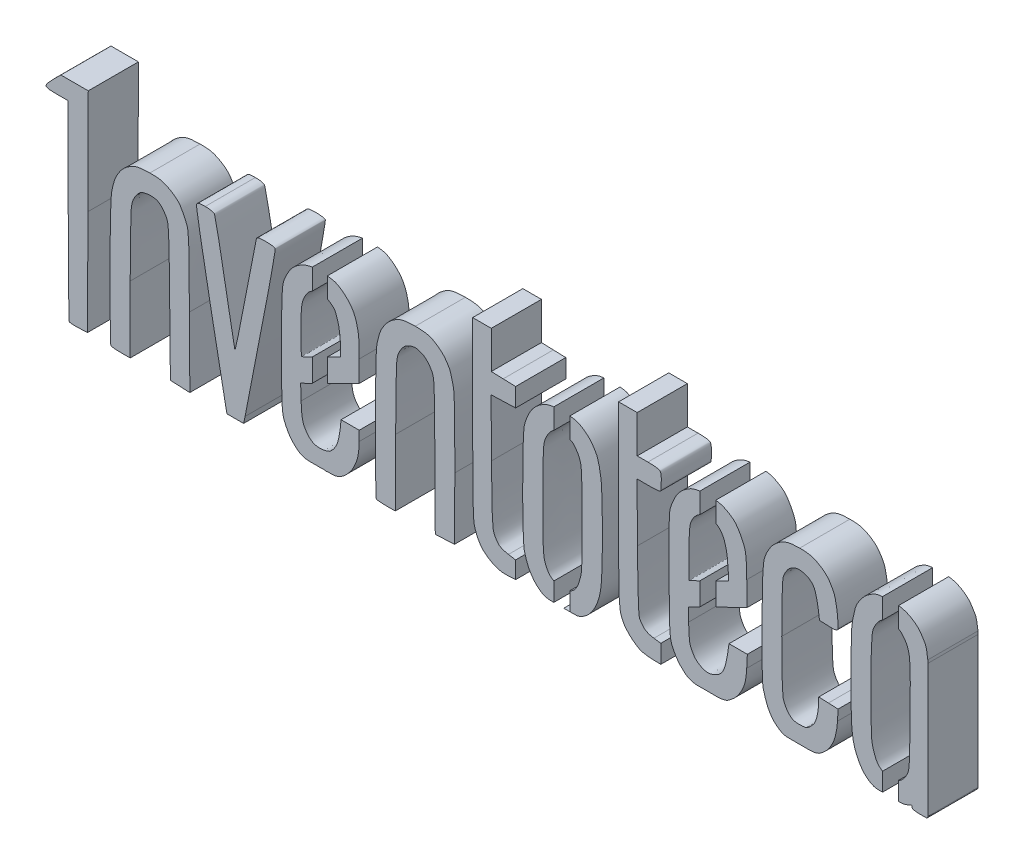
from build123d import *

# Parameters (mm, degrees)
SALIENTE_EXTRUIR2_DEPTH    = 10
CORTAR_EXTRUIR2_DEPTH      = 92.32283264
CORTAR_EXTRUIR2_DEPTH_BACK = 10
CROQUIS3_W                 = 3
CROQUIS3_H                 = 32.702645234
CROQUIS3_W_2               = 3.190612873
CROQUIS3_H_2               = 33.860503912
CROQUIS3_W_3               = 3.190612874
CROQUIS3_H_3               = 32.685335234
CROQUIS3_H_4               = 33.895445


# Read off the part's stored shape, not the designer's step: Saliente-Extruir2
with BuildPart() as part:
    # Saliente-Extruir2 outline → Saliente-Extruir2 (new body)
    # profile 1 of 11: a face of its own
    with BuildSketch(Plane.XY):
        with BuildLine():
            Line((-79.218099, -20.805759), (-79.146962, 0.095706))
            Line((-79.146962, 0.095706), (-79.075822, 21.000126))
            Line((-79.075822, 21.000126), (-84.541357, 21.000126))
            Line((-84.541357, 21.000126), (-86.020408, 19.539183))
            add(Edge.make_bspline(
                [(-86.020408, 19.539183), (-86.151057621, 19.407755057), (-86.403586436, 19.153721848), (-86.749067675, 18.776474773), (-87.004990583, 18.477835265), (-87.178945876, 18.258517235), (-87.285530373, 18.115907349), (-87.371645243, 17.989227664), (-87.439067324, 17.881342053), (-87.486328293, 17.788830583), (-87.50620533, 17.699889639), (-87.487234219, 17.614245837), (-87.433336517, 17.539963321), (-87.350967832, 17.48108526), (-87.2427641, 17.43566171), (-87.108126477, 17.398274028), (-86.867794342, 17.353677945), (-86.480480122, 17.31654641), (-85.904991074, 17.292995367), (-85.47191392, 17.291033463), (-85.229215, 17.289934)],
                knots=[0, 0, 0, 0, 0.115945695, 0.224108027, 0.320001004, 0.361964092, 0.399248074, 0.431375434, 0.457779313, 0.478835901, 0.496179998, 0.513637565, 0.531920245, 0.552362112, 0.576220356, 0.605016122, 0.639659586, 0.729037154, 0.848150868, 1, 1, 1, 1], degree=3))
            Line((-85.229215, 17.289934), (-83.066724, 17.289934))
            Line((-83.066724, 17.289934), (-83.066724, -1.589843))
            add(Edge.make_bspline(
                [(-83.066724, -1.589843), (-83.065439587, -3.26500503), (-83.062995174, -6.453065158), (-83.043420962, -10.929776943), (-83.018264646, -14.272178965), (-82.992078082, -16.563247392), (-82.971746807, -17.940258425), (-82.952612081, -18.928617905), (-82.935775964, -19.582981599), (-82.923712205, -19.964875403), (-82.912919084, -20.235684937), (-82.903822514, -20.413352857), (-82.897387989, -20.516735365), (-82.891715788, -20.590262338), (-82.886901015, -20.63896759), (-82.883485834, -20.668123289), (-82.880215269, -20.689429533), (-82.877748697, -20.704351243), (-82.87573651, -20.714244279), (-82.872885393, -20.723471214), (-82.87110743, -20.733571051), (-82.865753575, -20.746036469), (-82.850986578, -20.762380567), (-82.827662032, -20.780873949), (-82.794961899, -20.79680976), (-82.758049779, -20.809929322), (-82.716140494, -20.822273459), (-82.668605152, -20.833379757), (-82.594329202, -20.847735423), (-82.487961002, -20.863187422), (-82.345129737, -20.878057236), (-82.119335183, -20.894592686), (-81.800693744, -20.905825794), (-81.385114196, -20.906550917), (-81.093989627, -20.895082517), (-80.94319, -20.889142)],
                knots=[0, 0, 0, 0, 0.238070831, 0.453081021, 0.636226859, 0.7130989, 0.778704184, 0.831946137, 0.853587958, 0.871731508, 0.886246948, 0.892104564, 0.897013991, 0.900967726, 0.902584103, 0.903969484, 0.905138999, 0.905647015, 0.906119144, 0.906572339, 0.907017613, 0.9075736, 0.908472856, 0.910111159, 0.911781099, 0.913613368, 0.915676988, 0.917986328, 0.920548232, 0.926426521, 0.933254253, 0.940953551, 0.958597667, 0.978554004, 1, 1, 1, 1], degree=3))
            Line((-80.94319, -20.889142), (-79.218099, -20.805759))
        make_face()
    # profile 2 of 11: a face of its own
    with BuildSketch(Plane.XY):
        with BuildLine():
            Line((88.311123, 5.837721), (88.302478, 6.440604))
            add(Edge.make_bspline(
                [(88.302478, 6.440604), (88.282305496, 6.609175455), (88.220250139, 7.127740808), (88.091477079, 7.939534304), (87.894132078, 8.804306263), (87.478801986, 9.472824703), (87.098273468, 10.081076168), (86.677328234, 10.72132247), (86.091319874, 11.308745292), (85.368926427, 11.843493072), (84.49953473, 12.340381186), (83.523703275, 12.718396014), (82.38006427, 12.940584356), (81.587538344, 12.953521904), (81.15689, 12.960552)],
                knots=[0, 0, 0, 0, 0.047149464, 0.145042816, 0.229100541, 0.290415826, 0.362081233, 0.429042106, 0.502564977, 0.591198842, 0.678137552, 0.780107814, 0.880513429, 1, 1, 1, 1], degree=3))
            add(Edge.make_bspline(
                [(81.15689, 12.960552), (80.781049535, 12.952573226), (80.042077823, 12.936885483), (79.034933057, 12.830962362), (78.140634637, 12.705225303), (77.357516659, 12.347096285), (76.598381099, 11.870220177), (75.822866579, 11.269367672), (75.136716868, 10.497529596), (74.531952458, 9.653539229), (74.000705858, 8.721925124), (73.671117894, 7.599110182), (73.384727799, 6.324011927), (73.133011037, 4.683874633), (73.046385189, 2.394038035), (72.95714166, -0.668749673), (72.924674413, -4.266365166), (72.95680578, -7.858879197), (73.045198049, -10.908561632), (73.151759857, -13.231192449), (73.409605127, -14.903191749), (73.783002421, -16.289678337), (74.301834412, -17.511304626), (74.899791981, -18.582579559), (75.564342641, -19.465759464), (76.318952065, -20.133924756), (77.08110237, -20.628244243), (77.918604778, -20.915243109), (78.479286722, -20.917464892), (78.775076, -20.918637)],
                knots=[0, 0, 0, 0, 0.027265503, 0.05360901, 0.073606059, 0.092359671, 0.115529994, 0.138687807, 0.163281208, 0.190165697, 0.21404657, 0.240675843, 0.274653621, 0.308989324, 0.360915825, 0.440801379, 0.531490022, 0.622038654, 0.701564839, 0.753011837, 0.790661555, 0.824142607, 0.856969427, 0.886735022, 0.913056099, 0.936750601, 0.959542632, 0.978656606, 1, 1, 1, 1], degree=3))
            Line((78.775076, -20.918637), (81.710189, -20.922644))
            Line((81.710189, -20.922644), (82.624444, -20.934893))
            add(Edge.make_bspline(
                [(82.624444, -20.934893), (82.814961255, -20.927469101), (83.211361597, -20.912022543), (83.789036959, -20.79555297), (84.278341245, -20.616691078), (84.630954123, -20.416501474), (84.862488026, -20.305155684), (84.99748096, -20.237337864), (85.056495765, -20.240482069), (85.069620735, -20.243571856), (85.079157794, -20.248430513), (85.087023564, -20.254964786), (85.094087979, -20.264749292), (85.104381641, -20.286574385), (85.113245262, -20.328005662), (85.119707302, -20.392563492), (85.119510898, -20.47189942), (85.125401716, -20.558363845), (85.154034275, -20.641848934), (85.204748586, -20.715308802), (85.277935706, -20.77529819), (85.371025742, -20.823196018), (85.536896658, -20.87618802), (85.805512193, -20.934806981), (86.212882505, -20.988857108), (86.595247243, -21.002267186), (86.993781496, -20.997334983), (87.352141086, -20.995141194), (87.638492529, -20.988195813), (87.773345, -20.984925)],
                knots=[0, 0, 0, 0, 0.100353028, 0.208799852, 0.30891934, 0.373811957, 0.421046265, 0.446661669, 0.449751081, 0.451996252, 0.453713543, 0.455343419, 0.457336748, 0.460017531, 0.468006459, 0.479462806, 0.494193237, 0.509810045, 0.52488272, 0.540092088, 0.556237267, 0.574226853, 0.594938269, 0.647796861, 0.718902539, 0.811186014, 0.849077055, 0.928925338, 1, 1, 1, 1], degree=3))
            add(Edge.make_bspline(
                [(87.773345, -20.984925), (87.878260491, -20.995018697), (88.048383551, -21.011385877), (88.282444399, -20.849377969), (88.299416353, -20.683848585), (88.309542, -20.585092)],
                knots=[0, 0, 0, 0, 0.393583621, 0.638205563, 1, 1, 1, 1], degree=3))
            Line((88.309542, -20.585092), (88.311123, 5.837721))
        make_face()
        with BuildLine():
            add(Edge.make_bspline(
                [(81.057047, 9.116124), (81.349885696, 9.122860584), (81.871823097, 9.112244989), (82.624370182, 8.832742783), (83.200678123, 8.327021836), (83.72959394, 7.685686787), (84.147479536, 6.923660537), (84.569749723, 5.849514155), (84.786846331, 3.907506361), (84.822485623, 0.261232339), (84.796547648, -4.114838059), (84.756697074, -8.28979707), (84.716916399, -11.037655943), (84.656537774, -12.895640492), (84.566388582, -14.09930628), (84.413623643, -14.889872181), (84.145728277, -15.500842773), (83.794531572, -16.067967766), (83.383679929, -16.595544979), (82.954699226, -17.031370602), (82.45625329, -17.299253361), (81.954314696, -17.507084459), (81.424919647, -17.658039472), (80.863465307, -17.670210316), (80.291606222, -17.620115404), (79.696077795, -17.516051463), (79.12737418, -17.237129825), (78.605967416, -16.793437653), (78.119556691, -16.201313935), (77.745169253, -15.387455026), (77.420774679, -14.435768925), (77.089254953, -13.085745957), (77.00253047, -10.882386176), (76.926466689, -7.425570332), (76.956441586, -3.472692704), (76.99781847, 0.114784893), (77.040167317, 2.613918244), (77.105413322, 4.312835095), (77.203362937, 5.442762087), (77.380289998, 6.229573716), (77.661360156, 6.900499658), (78.034665201, 7.558440464), (78.488071114, 8.156313818), (78.976672993, 8.649559857), (79.593409061, 8.910347014), (80.287918892, 9.078539332), (80.793812189, 9.110068436), (81.057047, 9.116124)],
                knots=[0, 0, 0, 0, 0.014188249, 0.025167113, 0.038251926, 0.050962096, 0.065503895, 0.080335806, 0.106831477, 0.159724291, 0.258045857, 0.319580663, 0.362878011, 0.391747318, 0.409998922, 0.421596909, 0.43068422, 0.442285707, 0.453958916, 0.463220843, 0.471747884, 0.481243836, 0.489686264, 0.498328905, 0.508364834, 0.517647634, 0.52754889, 0.538747309, 0.550751247, 0.564518767, 0.58202687, 0.599689551, 0.631910051, 0.688832293, 0.768153251, 0.824106776, 0.863406785, 0.889743845, 0.906825493, 0.918516497, 0.928799329, 0.942106796, 0.955187263, 0.965323076, 0.975382589, 0.987246081, 1, 1, 1, 1], degree=3))
        make_face(mode=Mode.SUBTRACT)
    # profile 3 of 11: a face of its own
    with BuildSketch(Plane.XY):
        with BuildLine():
            Line((66.720352, 2.468552), (68.452826, 2.384746))
            add(Edge.make_bspline(
                [(68.452826, 2.384746), (68.647507005, 2.376376701), (68.99346846, 2.361503883), (69.454584411, 2.364625097), (69.766689494, 2.392577076), (69.963576832, 2.436524133), (70.079690858, 2.477225129), (70.176874032, 2.529350369), (70.255556493, 2.594339736), (70.315473167, 2.671502042), (70.35830883, 2.756160899), (70.382453457, 2.855512917), (70.395133904, 2.974260822), (70.40315939, 3.122429049), (70.407019715, 3.299339581), (70.405833682, 3.502612617), (70.397795118, 3.81743707), (70.375203439, 4.253671102), (70.331772887, 4.813454017), (70.251011392, 5.619276473), (70.102518285, 6.620842501), (69.883242004, 7.69218358), (69.641588188, 8.576035142), (69.275436214, 9.28279583), (68.889246373, 9.937145018), (68.454476282, 10.608437398), (67.848181166, 11.21351133), (67.118253786, 11.773792899), (66.237591964, 12.300538653), (65.258974499, 12.725040732), (64.06325152, 12.956125965), (63.231967452, 12.961667593), (62.764184, 12.964786)],
                knots=[0, 0, 0, 0, 0.035121612, 0.062413505, 0.083103872, 0.091437, 0.098720786, 0.105217816, 0.111216516, 0.116972089, 0.122715165, 0.128178974, 0.135299765, 0.144223812, 0.154923219, 0.167193973, 0.180865004, 0.211692235, 0.245925745, 0.282070913, 0.357677869, 0.428263974, 0.479343381, 0.522065438, 0.571166038, 0.616523829, 0.665683595, 0.724660247, 0.782073656, 0.850364038, 0.915796261, 1, 1, 1, 1], degree=3))
            add(Edge.make_bspline(
                [(62.764184, 12.964786), (62.316652447, 12.958867478), (61.515161869, 12.948267915), (60.400026408, 12.764192032), (59.489897897, 12.424261996), (58.692114605, 11.928542817), (57.976288505, 11.364326371), (57.299410898, 10.715783656), (56.750646305, 9.923295115), (56.264253898, 9.068256823), (55.886443316, 8.235370893), (55.644946534, 7.405673374), (55.501384071, 6.439247583), (55.4075848, 5.062511579), (55.342461857, 3.066735408), (55.294973593, 0.242622868), (55.258956025, -2.929489619), (55.234485183, -6.04511457), (55.234802375, -8.621277069), (55.255339261, -10.785278193), (55.295820726, -12.510805742), (55.351671759, -13.771751209), (55.446753211, -14.805297017), (55.710358627, -15.777527769), (56.04908557, -16.815366735), (56.455121885, -17.826818968), (56.982929986, -18.721412786), (57.603412683, -19.504479389), (58.325243367, -20.145969625), (59.073759615, -20.62963717), (59.908823837, -20.914215707), (60.560527037, -20.920672715), (61.0185462, -20.916930819), (61.243033649, -20.928541594), (61.378752882, -20.92681253), (61.438763, -20.926048)],
                knots=[0, 0, 0, 0, 0.032311609, 0.057867316, 0.081261483, 0.101994973, 0.125474061, 0.147081598, 0.169430144, 0.194817248, 0.218155538, 0.23531951, 0.257081915, 0.288605504, 0.335005051, 0.401363229, 0.492709862, 0.564242628, 0.626511739, 0.678864234, 0.720628985, 0.751211893, 0.770106418, 0.795464886, 0.823731754, 0.849055998, 0.8740271, 0.898529196, 0.920936364, 0.943536553, 0.962538021, 0.98376943, 0.99019347, 0.995663909, 1, 1, 1, 1], degree=3))
            Line((61.438763, -20.926048), (64.7527, -20.928305))
            add(Edge.make_bspline(
                [(64.7527, -20.928305), (64.968503286, -20.919178692), (65.410514251, -20.900486075), (66.033775489, -20.764652403), (66.630922661, -20.560076343), (67.169553907, -20.177103193), (67.714249423, -19.715837229), (68.282879478, -19.155566028), (68.791385233, -18.43493759), (69.257424785, -17.61123599), (69.691147611, -16.684481437), (69.97408143, -15.602407832), (70.198568997, -14.408719469), (70.269440317, -13.557063637), (70.304371, -13.137304)],
                knots=[0, 0, 0, 0, 0.061410989, 0.125782748, 0.181153652, 0.239772896, 0.312426997, 0.384793703, 0.466325544, 0.56260936, 0.654347915, 0.756745613, 0.88010606, 1, 1, 1, 1], degree=3))
            Line((70.304371, -13.137304), (70.407385, -11.005))
            Line((70.407385, -11.005), (68.482807, -10.920773))
            Line((68.482807, -10.920773), (66.556112, -10.836332))
            Line((66.556112, -10.836332), (66.556112, -11.861428))
            add(Edge.make_bspline(
                [(66.556112, -11.861428), (66.544848091, -12.089113969), (66.519106799, -12.609442306), (66.404631768, -13.416839066), (66.253254226, -14.309953577), (66.01350335, -15.180638572), (65.609497117, -15.982385162), (65.131309581, -16.545452301), (64.712276622, -16.943658122), (64.392353855, -17.20002581), (64.068389596, -17.371680116), (63.706065848, -17.468379915), (63.272900044, -17.509860155), (62.783566878, -17.516410814), (62.295816239, -17.509506178), (61.869849122, -17.469181719), (61.515079228, -17.380327088), (61.202465792, -17.226731567), (60.904798308, -16.998199226), (60.531728058, -16.653690748), (60.125408667, -16.121570447), (59.756681229, -15.433334453), (59.474386479, -14.729087354), (59.383423836, -13.882605599), (59.311665295, -12.775051635), (59.255429504, -11.207210073), (59.213951326, -9.202498624), (59.188395146, -6.776740817), (59.185902105, -5.021202315), (59.18456, -4.076125)],
                knots=[0, 0, 0, 0, 0.029724236, 0.067928481, 0.10626139, 0.147891993, 0.185256192, 0.222345096, 0.243591911, 0.260668528, 0.275658631, 0.291044076, 0.309252057, 0.33229219, 0.354865312, 0.372864618, 0.387993611, 0.402303347, 0.417948281, 0.436784727, 0.468439648, 0.504650534, 0.538577231, 0.566472693, 0.615117932, 0.683573779, 0.770995975, 0.876717879, 1, 1, 1, 1], degree=3))
            add(Edge.make_bspline(
                [(59.18456, -4.076125), (59.186209404, -3.171571162), (59.189309959, -1.47118839), (59.216094887, 0.900034188), (59.251841428, 2.650114708), (59.289704528, 3.850440346), (59.32003493, 4.586814483), (59.352828861, 5.205356397), (59.389625074, 5.699456262), (59.425325582, 6.061584343), (59.498135365, 6.481249901), (59.728317853, 6.996025573), (60.066902635, 7.620104138), (60.48022194, 8.204438528), (60.996908459, 8.656697717), (61.573011271, 8.987911645), (62.196064978, 9.183264454), (62.851914968, 9.198755292), (63.513175366, 9.109228573), (64.168587802, 8.917753555), (64.761071206, 8.576234801), (65.262197268, 8.12739494), (65.6884224, 7.549374717), (65.954374827, 6.733342747), (66.22156326, 5.739590917), (66.349673551, 4.982372141), (66.415935, 4.590722)],
                knots=[0, 0, 0, 0, 0.125456478, 0.23583343, 0.328892538, 0.368228166, 0.402393073, 0.431108738, 0.454133849, 0.471103611, 0.481576864, 0.513064698, 0.548443343, 0.580266193, 0.611679819, 0.64286139, 0.671889697, 0.701201125, 0.733032009, 0.764251782, 0.795252442, 0.827002851, 0.857063355, 0.893601132, 0.944968175, 1, 1, 1, 1], degree=3))
            Line((66.415935, 4.590722), (66.720352, 2.468552))
        make_face()
    # profile 4 of 11: a face of its own
    with BuildSketch(Plane.XY):
        with BuildLine():
            Line((52.309245, -2.514502), (52.206858, 2.237319))
            add(Edge.make_bspline(
                [(52.206858, 2.237319), (52.19291614, 2.879465391), (52.168969427, 3.982424131), (52.116274519, 5.417057058), (52.030901043, 6.464877508), (51.879086703, 7.280751885), (51.62526105, 8.005393284), (51.269216328, 8.812461191), (50.796642966, 9.708257609), (50.227221278, 10.563209045), (49.636776086, 11.272904828), (48.933496413, 11.761258129), (48.208697573, 12.190901311), (47.458493771, 12.547338735), (46.7036543, 12.781101378), (45.90424844, 12.916732368), (45.342859623, 12.936015067), (45.042613, 12.946328)],
                knots=[0, 0, 0, 0, 0.131622863, 0.226077089, 0.294161502, 0.346922585, 0.395592201, 0.451108752, 0.527648697, 0.602725842, 0.661588615, 0.715308813, 0.77703054, 0.834392958, 0.884990253, 0.938489533, 1, 1, 1, 1], degree=3))
            add(Edge.make_bspline(
                [(45.042613, 12.946328), (44.929732259, 12.94711429), (44.696151446, 12.948741337), (44.333254762, 12.941071527), (43.583978285, 12.910893919), (42.590344883, 12.864198652), (41.363370938, 12.559876555), (40.390144014, 12.009859298), (39.487323139, 11.362718356), (38.724456809, 10.566453449), (38.09303076, 9.665892186), (37.588467567, 8.666381785), (37.190113016, 7.674230498), (36.891004548, 6.754435349), (36.794705966, 5.765639403), (36.735369371, 4.535313394), (36.694111215, 2.819593401), (36.672560494, 0.626408457), (36.672480591, -2.037522193), (36.700159867, -6.193597045), (36.769797946, -10.568046878), (36.833352874, -14.402792613), (37.148383422, -16.304697874), (37.648792624, -17.316812285), (38.100997598, -18.097958474), (38.612295532, -18.828503989), (39.194177751, -19.447771455), (39.7743068, -19.977988138), (40.348008547, -20.43579404), (40.990722217, -20.708208466), (41.661446563, -20.890568515), (42.136435407, -20.921760872), (42.366102, -20.936843)],
                knots=[0, 0, 0, 0, 0.008121041, 0.016804633, 0.02610914, 0.062081647, 0.088209753, 0.116155706, 0.141915558, 0.167940156, 0.195045051, 0.22076257, 0.248282399, 0.272016462, 0.289943947, 0.319513974, 0.360699949, 0.413373302, 0.477318803, 0.552341998, 0.712411572, 0.791883208, 0.828642639, 0.849441342, 0.872672344, 0.893622802, 0.9134096, 0.933638884, 0.950244027, 0.96583118, 0.983478693, 1, 1, 1, 1], degree=3))
            Line((42.366102, -20.936843), (43.474372, -20.929025))
            add(Edge.make_bspline(
                [(43.474372, -20.929025), (43.6074345, -20.927110348), (44.017144116, -20.921214987), (44.663469111, -20.91321685), (45.176598459, -20.924037792), (45.413092, -20.929025)],
                knots=[0, 0, 0, 0, 0.205911263, 0.634016534, 1, 1, 1, 1], degree=3))
            Line((45.413092, -20.929025), (46.465834, -20.937887))
            add(Edge.make_bspline(
                [(46.465834, -20.937887), (46.680235532, -20.927392806), (47.117430306, -20.905993672), (47.731366283, -20.771373376), (48.315286281, -20.567796449), (48.845608476, -20.1946107), (49.394594138, -19.75082502), (49.977443395, -19.214385556), (50.517634279, -18.530266397), (51.021752121, -17.750626877), (51.50569673, -16.85570941), (51.86751418, -15.804187083), (52.106911779, -14.515151963), (52.16834864, -13.580304727), (52.202007, -13.068146)],
                knots=[0, 0, 0, 0, 0.060044154, 0.122438446, 0.175578701, 0.231981744, 0.30276158, 0.373724937, 0.453280774, 0.546195349, 0.633738246, 0.737656289, 0.856274249, 1, 1, 1, 1], degree=3))
            Line((52.202007, -13.068146), (52.326554, -10.587108))
            Line((52.326554, -10.587108), (48.663377, -10.587108))
            Line((48.663377, -10.587108), (48.366152, -12.651227))
            add(Edge.make_bspline(
                [(48.366152, -12.651227), (48.299780422, -13.038899963), (48.169173809, -13.801766454), (47.902299107, -14.827371677), (47.610476219, -15.709804849), (47.205090992, -16.402723638), (46.606581069, -16.951726065), (45.845194411, -17.320561656), (45.097161236, -17.651630106), (44.311602166, -17.745097667), (43.628026232, -17.570273301), (42.963173419, -17.280387555), (42.383498631, -16.894776751), (41.859503947, -16.428386633), (41.473470703, -15.839178623), (41.14618938, -15.222347315), (40.915804272, -14.666791164), (40.81958552, -14.155594884), (40.756364577, -13.653997616), (40.700373078, -13.03980673), (40.657093046, -12.3502328), (40.627060222, -11.621532538), (40.622566041, -11.126557591), (40.620315, -10.878635)],
                knots=[0, 0, 0, 0, 0.074711575, 0.147018137, 0.201255574, 0.250924272, 0.29779685, 0.353140866, 0.410966041, 0.452536494, 0.500652409, 0.542992452, 0.590098165, 0.632408283, 0.675292364, 0.72297251, 0.765327177, 0.788761802, 0.821584099, 0.861420614, 0.905934722, 0.952884671, 1, 1, 1, 1], degree=3))
            Line((40.620315, -10.878635), (40.618622, -8.24054))
            Line((40.618622, -8.24054), (46.433331, -5.392616))
            Line((46.433331, -5.392616), (52.309245, -2.514502))
        make_face()
        with BuildLine():
            Line((48.545852, 0.20209), (44.700489, -1.724393))
            add(Edge.make_bspline(
                [(44.700489, -1.724393), (44.356378689, -1.896226029), (43.699406741, -2.22428792), (42.771109398, -2.681021399), (42.072236887, -3.02051743), (41.588237563, -3.252036904), (41.293643842, -3.391042608), (41.079849749, -3.490234061), (40.936462719, -3.554862578), (40.850916021, -3.592993153), (40.791935901, -3.617348117), (40.753214539, -3.634506232), (40.734808971, -3.638927342), (40.713175109, -3.654862169), (40.712875406, -3.634849185), (40.709123788, -3.62228126), (40.704303223, -3.586748427), (40.696883265, -3.525690848), (40.688991575, -3.430832136), (40.678014976, -3.266324906), (40.666770743, -3.015259808), (40.656289662, -2.663856787), (40.645437474, -2.075521544), (40.640631067, -1.213916009), (40.646403595, -0.056610877), (40.668944597, 1.407277787), (40.701576136, 2.944935283), (40.749794772, 4.379164723), (40.82190618, 5.410974499), (40.932288367, 6.161371), (41.112267316, 6.744008714), (41.391205815, 7.317869778), (41.777900337, 7.912056451), (42.322449389, 8.459791512), (42.898427881, 8.826312803), (43.450494722, 9.039584254), (43.947952252, 9.167098311), (44.281577706, 9.185742986), (44.445023772, 9.194876087)],
                knots=[0, 0, 0, 0, 0.059979846, 0.11451292, 0.161332485, 0.181143754, 0.198175821, 0.212137685, 0.217876107, 0.222734363, 0.226671262, 0.227993125, 0.229103596, 0.230066148, 0.230710934, 0.231406349, 0.232302639, 0.236167723, 0.2411167, 0.24708857, 0.261903935, 0.280287249, 0.301917853, 0.353661328, 0.414647882, 0.482389937, 0.58196773, 0.654492894, 0.70614392, 0.743232379, 0.772490673, 0.800823508, 0.842520669, 0.882461941, 0.920334198, 0.947999279, 0.974523502, 0.999998222, 0.999998222, 0.999998222, 0.999998222], degree=3))
            add(Edge.make_bspline(
                [(44.445023772, 9.194876087), (44.498204146, 9.19451349), (44.603972311, 9.193800461), (44.761454385, 9.181837215), (45.056631932, 9.142404838), (45.489881755, 9.033164012), (46.011641918, 8.846222602), (46.498962466, 8.627243185), (46.889453813, 8.241001695), (47.250461021, 7.769331024), (47.607357564, 7.17288505), (47.868110138, 6.397769146), (48.110194157, 5.494035335), (48.303691061, 4.488363281), (48.417698073, 3.44537439), (48.509681195, 2.44046124), (48.530954216, 1.780426034), (48.540546, 1.482823)],
                knots=[0, 0, 0, 0, 0.016345556, 0.032509114, 0.048511844, 0.107865782, 0.169227928, 0.219315345, 0.270208122, 0.335763646, 0.402119474, 0.482651577, 0.586034598, 0.689879935, 0.79702419, 0.908480311, 1, 1, 1, 1], degree=3))
            Line((48.540546, 1.482823), (48.545852, 0.20209))
        make_face(mode=Mode.SUBTRACT)
    # profile 5 of 11: a face of its own
    with BuildSketch(Plane.XY):
        with BuildLine():
            Line((30.334167, 8.70056), (32.651387, 8.70056))
            add(Edge.make_bspline(
                [(32.651387, 8.70056), (32.90705391, 8.701716224), (33.365814422, 8.703790915), (33.978673056, 8.727677379), (34.395497172, 8.764467259), (34.65743852, 8.808027897), (34.805596948, 8.844124898), (34.925603514, 8.887297061), (35.018019324, 8.941470796), (35.085736279, 9.010576558), (35.1298316, 9.183600459), (35.120356981, 9.51964689), (35.158140982, 10.051093048), (35.177149188, 10.582240874), (35.184046648, 11.034649304), (35.169207882, 11.365447719), (35.14015928, 11.670313783), (35.100666293, 11.93633867), (35.049163811, 12.150240866), (34.987990778, 12.30270387), (34.900734696, 12.391396696), (34.806148303, 12.445825856), (34.688427946, 12.492728906), (34.546155542, 12.534266383), (34.378525545, 12.570393919), (34.104212379, 12.614719311), (33.696014901, 12.654924251), (33.129459991, 12.683256978), (32.717869064, 12.686196251), (32.495394, 12.687785)],
                knots=[0, 0, 0, 0, 0.091634857, 0.164426652, 0.219802323, 0.241472585, 0.259533805, 0.274426211, 0.286967518, 0.29782877, 0.307914155, 0.34959933, 0.418060154, 0.498792035, 0.540099377, 0.580200466, 0.617394784, 0.649877589, 0.67639579, 0.696463613, 0.707563106, 0.720296868, 0.735301936, 0.75291606, 0.773355146, 0.796730955, 0.852481571, 0.920262645, 1, 1, 1, 1], degree=3))
            Line((32.495394, 12.687785), (30.366885, 12.687785))
            Line((30.366885, 12.687785), (30.366885, 20.168892))
            Line((30.366885, 20.168892), (26.656625, 20.168892))
            Line((26.656625, 20.168892), (26.656625, 2.709172))
            add(Edge.make_bspline(
                [(26.656625, 2.709172), (26.661711426, -1.073016882), (26.669245925, -6.675555146), (26.711212811, -12.974554325), (26.940451447, -15.88858057), (27.451335342, -17.234688533), (28.051154645, -18.177752392), (28.804101654, -18.981541869), (29.621782138, -19.687314075), (30.381071937, -20.222345756), (31.110470978, -20.612570142), (31.883969886, -20.756520585), (32.694100487, -20.876583074), (33.277311463, -20.904661575), (33.567342, -20.918625)],
                knots=[0, 0, 0, 0, 0.411894162, 0.610136849, 0.688321966, 0.72768062, 0.765748375, 0.809403929, 0.847223362, 0.883281585, 0.910650473, 0.936428778, 0.968386062, 1, 1, 1, 1], degree=3))
            Line((33.567342, -20.918625), (35.077121, -20.947968))
            Line((35.077121, -20.947968), (35.077121, -17.314969))
            Line((35.077121, -17.314969), (33.6938, -17.131525))
            add(Edge.make_bspline(
                [(33.6938, -17.131525), (33.437568635, -17.083791536), (32.940924426, -16.991271447), (32.288597485, -16.742423263), (31.759775722, -16.424656304), (31.39787398, -15.993384942), (31.09172306, -15.559953222), (30.855698373, -15.199813199), (30.771250013, -14.865738347), (30.727740079, -14.534734503), (30.681235676, -14.058759347), (30.640971162, -13.43601807), (30.602575292, -12.663935037), (30.552429077, -11.324331935), (30.501626384, -9.247362603), (30.454900203, -6.254787407), (30.435318606, -4.03684594), (30.424515, -2.813158)],
                knots=[0, 0, 0, 0, 0.048815894, 0.094618125, 0.130448423, 0.163099929, 0.199111043, 0.230695252, 0.2425188, 0.263434198, 0.293323922, 0.332245134, 0.380521378, 0.438382084, 0.583790504, 0.770367907, 1, 1, 1, 1], degree=3))
            Line((30.424515, -2.813158), (30.334167, 8.70056))
        make_face()
    # profile 6 of 11: a face of its own
    with BuildSketch(Plane.XY):
        with BuildLine():
            Line((13.273004, -20.919325), (14.381268, -20.908347))
            add(Edge.make_bspline(
                [(14.381268, -20.908347), (14.665207002, -20.910273143), (15.233628365, -20.914129114), (16.085905849, -20.93954591), (16.654485897, -20.931896132), (16.938571, -20.928074)],
                knots=[0, 0, 0, 0, 0.333068661, 0.666774698, 1, 1, 1, 1], degree=3))
            add(Edge.make_bspline(
                [(16.938571, -20.928074), (17.010702906, -20.928732343), (17.168664254, -20.930174044), (17.382640797, -20.919518372), (17.816490847, -20.916321323), (18.440604765, -20.953664971), (19.280891865, -20.620284183), (20.047618335, -20.100476743), (20.818664171, -19.419813755), (21.488137517, -18.537731319), (22.084062945, -17.479219766), (22.592323835, -16.270545849), (22.959707747, -14.895853848), (23.217491838, -13.228686228), (23.323458367, -10.908578053), (23.412005607, -7.858928667), (23.443852053, -4.266402226), (23.411696228, -0.668788141), (23.322451544, 2.394001466), (23.235819496, 4.683833931), (22.984110248, 6.323972938), (22.697698832, 7.599057672), (22.368121643, 8.722149334), (21.836110034, 9.654360177), (21.229942308, 10.49953295), (20.535710233, 11.279894841), (19.741708739, 11.892219607), (18.937201321, 12.378033354), (18.089179926, 12.740600629), (17.107922097, 12.86467239), (16.000229703, 12.945886071), (15.192255984, 12.930070711), (14.782137, 12.922043)],
                knots=[0, 0, 0, 0, 0.005102795, 0.011174589, 0.015145393, 0.035827506, 0.054660176, 0.077724272, 0.101290735, 0.127058654, 0.155643692, 0.187070618, 0.219551278, 0.256061406, 0.306202603, 0.383710309, 0.471960801, 0.560347713, 0.638205689, 0.688814191, 0.722278406, 0.755393709, 0.781347211, 0.804639166, 0.830885939, 0.854917795, 0.878213597, 0.901502215, 0.921364762, 0.942876298, 0.971004608, 1, 1, 1, 1], degree=3))
            add(Edge.make_bspline(
                [(14.782137, 12.922043), (14.300361273, 12.899623167), (13.460396334, 12.860534703), (12.261379466, 12.55321557), (11.297247126, 12.0106001), (10.402653017, 11.367756269), (9.649024057, 10.588867965), (9.021996595, 9.708231953), (8.530936301, 8.711736009), (8.138113367, 7.697193053), (7.846031097, 6.749173974), (7.742041747, 5.75007577), (7.671614186, 4.549414195), (7.613409636, 2.916914433), (7.570081533, 0.883262703), (7.543647134, -1.521307934), (7.5354745, -4.15532005), (7.543627165, -6.784723338), (7.569964264, -9.173865086), (7.612470156, -11.194573262), (7.670284245, -12.811719503), (7.736947252, -13.990804733), (7.840470337, -14.941872878), (8.098286971, -15.810494596), (8.410504679, -16.722202518), (8.771675298, -17.583644743), (9.224349724, -18.339341542), (9.699620062, -19.007039108), (10.193816707, -19.568499141), (10.700701075, -19.986447155), (11.146101199, -20.341643792), (11.451092855, -20.533975875), (11.583797, -20.617661)],
                knots=[0, 0, 0, 0, 0.037258315, 0.064959018, 0.094819297, 0.122277529, 0.14999704, 0.178249774, 0.205587067, 0.235695682, 0.262471296, 0.281961058, 0.313216172, 0.355586034, 0.408327844, 0.470618159, 0.541652303, 0.612142787, 0.67407606, 0.726525773, 0.768539537, 0.799261241, 0.817944401, 0.842381279, 0.869103954, 0.892580303, 0.914472393, 0.937106376, 0.955962018, 0.972119782, 0.987869109, 1, 1, 1, 1], degree=3))
            Line((11.583797, -20.617661), (11.664005, -20.661989))
            Line((11.664005, -20.661989), (11.664005, -20.64912))
            add(Edge.make_bspline(
                [(11.664005, -20.64912), (11.724740063, -20.674106137), (11.855777298, -20.728014278), (12.075180535, -20.788260239), (12.336982851, -20.842958581), (12.633900877, -20.885407781), (12.952903249, -20.915395059), (13.167144894, -20.918025346), (13.273004, -20.919325)],
                knots=[0, 0, 0, 0, 0.119929325, 0.25875016, 0.414950218, 0.608578467, 0.806594401, 1, 1, 1, 1], degree=3))
        make_face()
        with BuildLine():
            add(Edge.make_bspline(
                [(15.311577, 9.116124), (15.574829773, 9.110090309), (16.080774967, 9.078524254), (16.77535686, 8.910352052), (17.392161986, 8.649579301), (17.880769748, 8.156310735), (18.334177541, 7.558439146), (18.70755182, 6.900382347), (18.98887384, 6.228797045), (19.165576051, 5.439490687), (19.263192688, 4.303837231), (19.3282584, 2.593774684), (19.370103375, 0.076142668), (19.402854917, -2.732726241), (19.423877854, -5.478406741), (19.419620823, -7.7129275), (19.39715531, -9.640393021), (19.355225172, -11.210725935), (19.301826209, -12.371941074), (19.212740292, -13.316290067), (19.002704131, -14.159127919), (18.76166725, -14.993520967), (18.509962206, -15.7124092), (18.172170979, -16.272506964), (17.819308262, -16.720592178), (17.431469955, -17.09363744), (16.948928256, -17.313840701), (16.431880862, -17.499407352), (15.872725718, -17.642978305), (15.29988792, -17.671528435), (14.760217284, -17.629375433), (14.253833064, -17.514521216), (13.807593606, -17.262008503), (13.37362537, -16.972243036), (12.920906309, -16.63107721), (12.547108509, -16.103739036), (12.209940904, -15.446958201), (11.813480187, -14.442234237), (11.614149968, -12.566725124), (11.532262607, -9.098008618), (11.521375471, -4.270777457), (11.530638004, 0.558536356), (11.617092839, 4.023497986), (11.809968171, 5.917625055), (12.239831907, 6.95954908), (12.654125464, 7.696696823), (13.173944627, 8.333786072), (13.746627849, 8.833866938), (14.497574345, 9.112114123), (15.018966675, 9.122830559), (15.311577, 9.116124)],
                knots=[0, 0, 0, 0, 0.012752744, 0.024616001, 0.034674808, 0.044808946, 0.057887312, 0.071192667, 0.081480656, 0.093196151, 0.11035628, 0.136858519, 0.176442368, 0.232830407, 0.273503983, 0.310004328, 0.3415232, 0.36726927, 0.386407432, 0.398080305, 0.413330383, 0.428535523, 0.440385802, 0.45022525, 0.460174037, 0.468137353, 0.476079008, 0.48569948, 0.494919154, 0.504018451, 0.5134484, 0.521227182, 0.529027282, 0.538181827, 0.54669566, 0.556375117, 0.569261724, 0.582631865, 0.608629466, 0.660164336, 0.751786296, 0.84330248, 0.894875213, 0.920855468, 0.93496284, 0.949381537, 0.961836614, 0.974863113, 0.98582509, 1, 1, 1, 1], degree=3))
        make_face(mode=Mode.SUBTRACT)
    # profile 7 of 11: a face of its own
    with BuildSketch(Plane.XY):
        with BuildLine():
            Line((6.122475, -17.396452), (4.69418, -17.157069))
            add(Edge.make_bspline(
                [(4.69418, -17.157069), (4.566490683, -17.132885565), (4.309849987, -17.084279671), (3.93584527, -16.982249931), (3.58170013, -16.866239413), (3.267485231, -16.739258481), (3.010793305, -16.613637251), (2.735465427, -16.427591059), (2.462884616, -16.07581232), (2.144945529, -15.603486441), (1.69902515, -14.824201815), (1.477697084, -12.907326016), (1.386592911, -8.803744562), (1.350248139, -5.140406274), (1.325894, -2.685653)],
                knots=[0, 0, 0, 0, 0.024156622, 0.048552005, 0.072020337, 0.093417779, 0.111517339, 0.125098467, 0.154805922, 0.193068859, 0.231545452, 0.320141715, 0.544436189, 1, 1, 1, 1], degree=3))
            Line((1.325894, -2.685653), (1.231115, 8.680085))
            Line((1.231115, 8.680085), (3.62412, 8.758613))
            Line((3.62412, 8.758613), (6.122475, 8.840729))
            Line((6.122475, 8.840729), (6.122475, 12.547402))
            Line((6.122475, 12.547402), (3.645651, 12.629096))
            Line((3.645651, 12.629096), (1.273548, 12.707416))
            Line((1.273548, 12.707416), (1.273548, 20.168892))
            Line((1.273548, 20.168892), (-2.436721, 20.168892))
            Line((-2.436721, 20.168892), (-2.436721, 2.884804))
            add(Edge.make_bspline(
                [(-2.436721, 2.884804), (-2.434362244, -0.859889648), (-2.430861758, -6.417163279), (-2.372113047, -12.678604868), (-2.161058301, -15.57765772), (-1.656437237, -16.910927825), (-1.221129619, -17.794020027), (-0.716503111, -18.600490001), (-0.029882697, -19.241568702), (0.732491934, -19.816088444), (1.610228624, -20.324307523), (2.531399082, -20.693279461), (3.53329966, -20.903209401), (4.199259234, -20.888930781), (4.547046, -20.881474)],
                knots=[0, 0, 0, 0, 0.404978638, 0.601004333, 0.680120394, 0.716412805, 0.754467537, 0.786795809, 0.818637561, 0.855447294, 0.890060812, 0.92809759, 0.962450113, 1, 1, 1, 1], degree=3))
            Line((4.547046, -20.881474), (6.122475, -20.8059))
            Line((6.122475, -20.8059), (6.122475, -17.396452))
        make_face()
    # profile 8 of 11: a face of its own
    with BuildSketch(Plane.XY):
        with BuildLine():
            Line((-6.06944, -20.806196), (-5.993014, -8.424862))
            add(Edge.make_bspline(
                [(-5.993014, -8.424862), (-5.987116201, -7.20736272), (-5.976040959, -4.921068961), (-5.983159806, -1.730640079), (-6.008216091, 0.965100598), (-6.051799527, 3.118687199), (-6.107907298, 4.683156423), (-6.198227023, 5.906807884), (-6.420739713, 6.963404054), (-6.681920399, 7.986691647), (-6.970940582, 8.887506687), (-7.401094708, 9.644237239), (-7.886538373, 10.340470573), (-8.441088564, 11.001887154), (-9.100848903, 11.557073691), (-9.792656713, 12.044695548), (-10.552819341, 12.486750498), (-11.456418617, 12.776315328), (-12.587655524, 12.933038298), (-13.418704163, 12.945622613), (-13.881329, 12.952628)],
                knots=[0, 0, 0, 0, 0.140802393, 0.264407246, 0.368960237, 0.452576499, 0.513485862, 0.550045338, 0.594281024, 0.638056079, 0.672320593, 0.703208069, 0.738257862, 0.770479329, 0.80266593, 0.83762624, 0.868367392, 0.903940838, 0.94652617, 1, 1, 1, 1], degree=3))
            add(Edge.make_bspline(
                [(-13.881329, 12.952628), (-14.344000434, 12.945687764), (-15.174197071, 12.933234518), (-16.303564403, 12.776777392), (-17.201637243, 12.48760148), (-17.950940162, 12.050123543), (-18.624759276, 11.571023594), (-19.263153647, 11.023327503), (-19.800781133, 10.36222094), (-20.286969865, 9.656683208), (-20.731068598, 8.888618717), (-21.051330898, 7.996027792), (-21.327371975, 7.009360982), (-21.520024829, 6.183911254), (-21.592367337, 5.525831278), (-21.626029576, 4.979954748), (-21.661018559, 4.255830409), (-21.693078849, 3.365097632), (-21.72288011, 2.320690343), (-21.760350266, 0.658995667), (-21.796440749, -1.703617283), (-21.824406741, -4.81991244), (-21.828144549, -7.020441622), (-21.830098, -8.170481)],
                knots=[0, 0, 0, 0, 0.054063526, 0.09700914, 0.132845026, 0.16351917, 0.198026873, 0.22950034, 0.261481683, 0.297292045, 0.329695131, 0.364843458, 0.407751433, 0.449576616, 0.463659686, 0.48510305, 0.513508108, 0.548416579, 0.589303978, 0.63565988, 0.742734827, 0.865548214, 1, 1, 1, 1], degree=3))
            add(Edge.make_bspline(
                [(-21.830098, -8.170481), (-21.829184912, -9.26414111), (-21.827446083, -11.346839296), (-21.809283458, -14.273324373), (-21.785814076, -16.46087355), (-21.76149564, -17.962606267), (-21.742554725, -18.867257088), (-21.724635727, -19.5176605), (-21.708907945, -19.949313589), (-21.697602929, -20.202301376), (-21.687470172, -20.382338574), (-21.678891167, -20.501134532), (-21.672822836, -20.571028345), (-21.667450883, -20.621197923), (-21.662818984, -20.654924115), (-21.659410878, -20.675700604), (-21.65628391, -20.691283261), (-21.653585741, -20.702564924), (-21.651565458, -20.710506254), (-21.648854042, -20.718292768), (-21.645917378, -20.726820487), (-21.64058286, -20.736724584), (-21.62745156, -20.751542774), (-21.605353068, -20.768739159), (-21.573104406, -20.784314147), (-21.536450361, -20.797337681), (-21.494541258, -20.810187882), (-21.446587786, -20.822138842), (-21.371113941, -20.838243917), (-21.262480815, -20.856631428), (-21.116075486, -20.876121914), (-20.883522642, -20.900730792), (-20.554201876, -20.924622918), (-20.123440188, -20.943339685), (-19.820837434, -20.94574828), (-19.663955, -20.946997)],
                knots=[0, 0, 0, 0, 0.225079035, 0.428626494, 0.602290541, 0.675308122, 0.737728236, 0.788511192, 0.809212312, 0.826622216, 0.840628425, 0.846321514, 0.851133814, 0.85506657, 0.856703914, 0.858139296, 0.859399118, 0.859973443, 0.860526869, 0.861084244, 0.861669636, 0.86238178, 0.863381902, 0.86572047, 0.868091738, 0.870720627, 0.873722513, 0.877109645, 0.880887726, 0.88960314, 0.899775457, 0.911280816, 0.937725556, 0.967714219, 1, 1, 1, 1], degree=3))
            Line((-19.663955, -20.946997), (-17.865604, -20.946997))
            Line((-17.865604, -20.946997), (-17.785808, -7.6628))
            add(Edge.make_bspline(
                [(-17.785808, -7.6628), (-17.774741493, -5.837064134), (-17.756090709, -2.760085436), (-17.720441155, 1.118699831), (-17.660586924, 3.650056705), (-17.572040166, 5.211013994), (-17.400720202, 6.18599645), (-17.089886755, 6.921490242), (-16.704086877, 7.610000509), (-16.199001123, 8.237823941), (-15.642309164, 8.712462008), (-15.031534354, 8.991559497), (-14.454775398, 9.179222488), (-13.882747717, 9.284939832), (-13.314383466, 9.182301841), (-12.74783028, 9.00094798), (-12.154702054, 8.734166972), (-11.618179078, 8.266812262), (-11.11302659, 7.691514194), (-10.755786858, 7.152378374), (-10.538726431, 6.734132816), (-10.408848931, 6.440472639), (-10.307655582, 6.09066747), (-10.22843276, 5.637489867), (-10.166417793, 5.030793592), (-10.091755853, 3.770707164), (-10.042329695, 1.43477996), (-10.00418231, -2.512363904), (-9.985611529, -5.660108805), (-9.974541, -7.536562)],
                knots=[0, 0, 0, 0, 0.145930817, 0.245942484, 0.310053841, 0.348273449, 0.370922185, 0.388671677, 0.411815647, 0.433817437, 0.452785347, 0.469666874, 0.487065739, 0.501352025, 0.515530398, 0.532601032, 0.549004975, 0.567033408, 0.588919114, 0.610137384, 0.618500357, 0.626575315, 0.635757603, 0.647522581, 0.663302914, 0.684478477, 0.748401941, 0.850015806, 1, 1, 1, 1], degree=3))
            Line((-9.974541, -7.536562), (-9.892428, -20.974229))
            Line((-9.892428, -20.974229), (-7.978606, -20.890211))
            Line((-7.978606, -20.890211), (-6.06944, -20.806196))
        make_face()
    # profile 9 of 11: a face of its own
    with BuildSketch(Plane.XY):
        with BuildLine():
            Line((-25.049178, -2.5112), (-25.049178, 1.723852))
            add(Edge.make_bspline(
                [(-25.049178, 1.723852), (-25.050682703, 2.649295286), (-25.053174241, 4.181675025), (-25.20028571, 6.22879818), (-25.58889283, 7.746764946), (-26.026691427, 9.013336879), (-26.664469228, 10.094555042), (-27.459438234, 10.960741626), (-28.306655935, 11.712342105), (-29.12865222, 12.272253632), (-29.962287275, 12.663512848), (-30.896935734, 12.815849523), (-31.923570308, 12.936025072), (-32.670357768, 12.955176187), (-33.046842, 12.964831)],
                knots=[0, 0, 0, 0, 0.174122736, 0.28831821, 0.384595574, 0.467994493, 0.539585236, 0.618856537, 0.688095391, 0.75224172, 0.805462545, 0.859622451, 0.929230287, 1, 1, 1, 1], degree=3))
            add(Edge.make_bspline(
                [(-33.046842, 12.964831), (-33.480537678, 12.959783633), (-34.26895267, 12.950608029), (-35.415846823, 12.710911477), (-36.399246184, 12.285721671), (-37.30526167, 11.74079147), (-38.074779439, 11.114966691), (-38.728117566, 10.407989502), (-39.226917079, 9.584560746), (-39.673124288, 8.73110232), (-40.030181782, 7.909598205), (-40.26472533, 7.083297996), (-40.393577554, 6.089277795), (-40.471840948, 4.639914278), (-40.515053906, 2.506182876), (-40.533749808, -0.539050162), (-40.535731784, -4.312922302), (-40.534212826, -8.097628004), (-40.517482279, -11.188418639), (-40.473038967, -13.304908046), (-40.390548983, -14.713818652), (-40.239564762, -15.680173017), (-39.976026362, -16.49549293), (-39.606357553, -17.315135186), (-39.148813125, -18.142947496), (-38.652330776, -18.883277516), (-38.081543613, -19.477359624), (-37.524582536, -19.998919705), (-37.115357477, -20.285982015), (-36.929105, -20.416634)],
                knots=[0, 0, 0, 0, 0.033473823, 0.060852033, 0.089936012, 0.115893349, 0.142389764, 0.166391804, 0.189901595, 0.216553026, 0.240884925, 0.259000516, 0.282766774, 0.318191095, 0.371217386, 0.447754968, 0.553655247, 0.663008531, 0.740386772, 0.792635571, 0.826674892, 0.849466795, 0.868016043, 0.892740653, 0.918872333, 0.94112121, 0.961394515, 0.982429309, 1, 1, 1, 1], degree=3))
            Line((-36.929105, -20.416634), (-36.846984, -20.466666))
            Line((-36.846984, -20.466666), (-36.846984, -20.456534))
            add(Edge.make_bspline(
                [(-36.846984, -20.456534), (-36.654909048, -20.545445704), (-36.253265995, -20.73136671), (-35.606132473, -20.890789639), (-35.157001584, -20.914911024), (-34.938445, -20.926649)],
                knots=[0, 0, 0, 0, 0.319971178, 0.669083602, 1, 1, 1, 1], degree=3))
            Line((-34.938445, -20.926649), (-33.830181, -20.908276))
            Line((-33.830181, -20.908276), (-32.692927, -20.941076))
            add(Edge.make_bspline(
                [(-32.692927, -20.941076), (-32.480566383, -20.901387694), (-32.182423177, -20.845667388), (-31.549474845, -21.025023273), (-31.565558786, -20.912549037), (-31.56605, -20.909114)],
                knots=[0, 0, 0, 0, 0.705879097, 0.991017354, 1, 1, 1, 1], degree=3))
            add(Edge.make_bspline(
                [(-31.56605, -20.909114), (-31.555671933, -20.912825973), (-31.534148001, -20.920524542), (-31.498794528, -20.909057917), (-31.461440104, -20.910027562), (-31.422658833, -20.910518799), (-31.380373184, -20.896639826), (-31.29223001, -20.897996957), (-31.148606351, -20.907269677), (-30.938529611, -20.91206913), (-30.518472854, -20.926364085), (-29.9114291, -20.898423203), (-29.148511081, -20.666491218), (-28.454808674, -20.273636589), (-27.803959842, -19.72425052), (-27.201707828, -19.098969625), (-26.636576543, -18.394520086), (-26.182842551, -17.580419381), (-25.782809356, -16.723169022), (-25.430968925, -15.810342927), (-25.231736935, -14.793089983), (-25.088004669, -13.692455783), (-25.061960847, -12.912801488), (-25.049178, -12.530131)],
                knots=[0, 0, 0, 0, 0.002680841, 0.005560017, 0.00891195, 0.012022953, 0.015169468, 0.019892594, 0.033833154, 0.051275044, 0.072316033, 0.13894356, 0.201935129, 0.269662023, 0.336675457, 0.414044533, 0.486410349, 0.561583405, 0.64617228, 0.722874059, 0.80520773, 0.904391916, 1, 1, 1, 1], degree=3))
            Line((-25.049178, -12.530131), (-25.049178, -10.586975))
            Line((-25.049178, -10.586975), (-28.677531, -10.586975))
            Line((-28.677531, -10.586975), (-28.871322, -12.505855))
            add(Edge.make_bspline(
                [(-28.871322, -12.505855), (-28.921738532, -12.872336709), (-29.022846219, -13.607296375), (-29.275522521, -14.611868918), (-29.562643328, -15.484011563), (-29.977389907, -16.162052865), (-30.40218426, -16.704527026), (-30.858740982, -17.157717911), (-31.441236197, -17.394806799), (-32.071253653, -17.562607679), (-32.77381742, -17.649847914), (-33.469439606, -17.604174335), (-34.125199444, -17.426492698), (-34.696771642, -17.114903335), (-35.17881895, -16.637021206), (-35.618107803, -16.084895272), (-36.058818547, -15.388827794), (-36.39226739, -14.436855578), (-36.569848762, -13.045206294), (-36.611337998, -11.973049441), (-36.636147, -11.33194)],
                knots=[0, 0, 0, 0, 0.071676877, 0.143744182, 0.200762239, 0.248843087, 0.296831181, 0.334700408, 0.371627393, 0.416944393, 0.461259321, 0.508217191, 0.551219064, 0.592124549, 0.63283669, 0.681881622, 0.72892192, 0.79189717, 0.875562341, 1, 1, 1, 1], degree=3))
            Line((-36.636147, -11.33194), (-36.735151, -8.318724))
            Line((-36.735151, -8.318724), (-30.922561, -5.430055))
            Line((-30.922561, -5.430055), (-25.049178, -2.5112))
        make_face()
        with BuildLine():
            Line((-28.759153, 0.202082), (-32.604721, -1.724401))
            add(Edge.make_bspline(
                [(-32.604721, -1.724401), (-32.948591021, -1.896187131), (-33.604688712, -2.223951917), (-34.530791111, -2.680709586), (-35.226980194, -3.020283389), (-35.708224109, -3.25192802), (-36.000424151, -3.39091993), (-36.212113496, -3.490144795), (-36.35372708, -3.554851181), (-36.437934425, -3.593130585), (-36.495273298, -3.617207211), (-36.532156134, -3.634094376), (-36.548787461, -3.638190804), (-36.56809024, -3.653256225), (-36.568633173, -3.637251878), (-36.571586406, -3.627903191), (-36.576329903, -3.598185807), (-36.583260162, -3.54465296), (-36.591845452, -3.460243441), (-36.604000692, -3.313677885), (-36.617713241, -3.090002583), (-36.632327878, -2.776868249), (-36.65121879, -2.252561918), (-36.669554852, -1.48463562), (-36.68331878, -0.453063292), (-36.689873143, 1.178937909), (-36.674000613, 3.061104745), (-36.565904374, 4.942350434), (-36.339556783, 6.185526399), (-35.948791373, 7.03867089), (-35.550748942, 7.701715518), (-35.106893797, 8.281944792), (-34.551091795, 8.680948383), (-33.978119986, 8.979296742), (-33.519210062, 9.137537514), (-33.221613325, 9.174374849), (-33.070171097, 9.18517641), (-32.966651965, 9.185865449), (-32.913836, 9.186217)],
                knots=[0, 0, 0, 0, 0.060390396, 0.115223768, 0.162228843, 0.182085145, 0.199128967, 0.213073126, 0.218792603, 0.223624828, 0.227527261, 0.22874097, 0.229756757, 0.230655658, 0.23115669, 0.231660641, 0.232317514, 0.235786825, 0.240234537, 0.245601822, 0.25891193, 0.275425107, 0.294855572, 0.341333452, 0.396103942, 0.456930629, 0.597749833, 0.691651964, 0.753068402, 0.794651486, 0.838222807, 0.874656066, 0.90835916, 0.944640696, 0.976159764, 0.983740103, 0.991704121, 1, 1, 1, 1], degree=3))
            add(Edge.make_bspline(
                [(-32.913836, 9.186217), (-32.746612798, 9.178323936), (-32.407395793, 9.162312631), (-31.911187964, 9.06081672), (-31.383166062, 8.892761786), (-30.854266966, 8.589924698), (-30.358342769, 8.204822238), (-29.914834857, 7.737943727), (-29.63620265, 7.064683613), (-29.354447729, 6.255904792), (-29.099556401, 5.280663051), (-28.932808833, 4.184340802), (-28.804854521, 3.044089129), (-28.777684374, 2.26538545), (-28.764882, 1.898466)],
                knots=[0, 0, 0, 0, 0.053266997, 0.108053612, 0.160854662, 0.22918758, 0.30074428, 0.360923875, 0.431559142, 0.529964371, 0.634688572, 0.751828415, 0.883063374, 1, 1, 1, 1], degree=3))
            Line((-28.764882, 1.898466), (-28.759153, 0.202082))
        make_face(mode=Mode.SUBTRACT)
    # profile 10 of 11: a face of its own
    with BuildSketch(Plane.XY):
        with BuildLine():
            Line((-58.823552, -20.975502), (-58.907564, -7.120916))
            add(Edge.make_bspline(
                [(-58.907564, -7.120916), (-58.919115694, -5.22193987), (-58.938607132, -2.017753839), (-58.976498668, 2.028298391), (-59.03632605, 4.686526929), (-59.129344674, 6.349836127), (-59.303652488, 7.412803804), (-59.616846198, 8.238661654), (-59.993725185, 9.051839645), (-60.435758683, 9.853597163), (-60.886459143, 10.596381049), (-61.508285333, 11.203434301), (-62.239502763, 11.758248339), (-63.137068732, 12.287719368), (-64.138627497, 12.731773942), (-65.400579593, 12.960097525), (-66.281916426, 12.959104826), (-66.788707, 12.958534)],
                knots=[0, 0, 0, 0, 0.230936939, 0.389665201, 0.492078599, 0.554228804, 0.592256909, 0.622398694, 0.661294495, 0.7011834, 0.733829391, 0.766384415, 0.806088174, 0.845284478, 0.8929512, 0.93844428, 1, 1, 1, 1], degree=3))
            add(Edge.make_bspline(
                [(-66.788707, 12.958534), (-67.255646606, 12.950567925), (-68.090580209, 12.936323805), (-69.225580799, 12.775978217), (-70.124498275, 12.480047013), (-70.873940564, 12.034904143), (-71.546533642, 11.545770943), (-72.186790174, 10.98473865), (-72.724177399, 10.297212961), (-73.211849885, 9.55241999), (-73.659901524, 8.729929595), (-73.980512892, 7.767345511), (-74.25648592, 6.697844524), (-74.483746736, 5.618960039), (-74.557881221, 4.3559283), (-74.617749665, 2.721949491), (-74.67000256, 0.487594409), (-74.712662365, -2.212177288), (-74.741060435, -5.242522612), (-74.75154412, -8.426794072), (-74.745981758, -11.552881788), (-74.729601576, -14.414207182), (-74.706724336, -16.553219597), (-74.68282203, -18.021734971), (-74.664191671, -18.906472932), (-74.646506166, -19.54265012), (-74.630872081, -19.964980815), (-74.619632024, -20.212620404), (-74.609603135, -20.388900591), (-74.600971692, -20.505235104), (-74.594942243, -20.573727659), (-74.589506247, -20.622922441), (-74.58498158, -20.656089466), (-74.581360831, -20.676865876), (-74.578340988, -20.694704246), (-74.575368368, -20.711031813), (-74.570190832, -20.729675806), (-74.55217858, -20.748867962), (-74.527638015, -20.768813346), (-74.495190073, -20.784280218), (-74.458638185, -20.797341776), (-74.416808999, -20.81018517), (-74.369005828, -20.822150303), (-74.293709714, -20.838256353), (-74.185288929, -20.856634835), (-74.039163017, -20.876122056), (-73.807138645, -20.900731428), (-73.478644529, -20.924628498), (-73.049005298, -20.943344069), (-72.747203484, -20.945753727), (-72.590736, -20.947003)],
                knots=[0, 0, 0, 0, 0.03482657, 0.062273307, 0.085233669, 0.104890159, 0.127041267, 0.147288664, 0.16815465, 0.191897066, 0.213730576, 0.237802585, 0.267334862, 0.296219032, 0.319841439, 0.361598025, 0.418283138, 0.486584735, 0.56308688, 0.644411472, 0.724194461, 0.796353468, 0.857925264, 0.883814564, 0.905947583, 0.923958394, 0.931303393, 0.937482964, 0.942456041, 0.944477827, 0.946187481, 0.947586372, 0.948170783, 0.948684733, 0.949160336, 0.949519517, 0.949926945, 0.950580489, 0.951428178, 0.952288366, 0.953241024, 0.954326892, 0.955551007, 0.956917148, 0.960071686, 0.96375344, 0.967916233, 0.977480534, 0.988324907, 1, 1, 1, 1], degree=3))
            Line((-72.590736, -20.947003), (-70.712601, -20.947003))
            Line((-70.712601, -20.947003), (-70.712601, -7.662806))
            add(Edge.make_bspline(
                [(-70.712601, -7.662806), (-70.700922615, -5.843187511), (-70.681224353, -2.773985675), (-70.643938021, 1.098026935), (-70.583519137, 3.63070822), (-70.49476502, 5.195477368), (-70.326655149, 6.171714439), (-70.026033007, 6.89309687), (-69.64859114, 7.558373321), (-69.195123376, 8.156324716), (-68.706712229, 8.649412074), (-68.090330951, 8.910126744), (-67.397454393, 9.077570343), (-66.610516432, 9.130650463), (-65.845676555, 9.102333088), (-65.135954612, 8.879617222), (-64.607051742, 8.461583161), (-64.148313758, 7.946486596), (-63.75515555, 7.393497943), (-63.241206137, 6.553276458), (-63.037638716, 4.399443271), (-62.915626564, -0.313319035), (-62.870441388, -4.574798831), (-62.839899, -7.455296)],
                knots=[0, 0, 0, 0, 0.145703024, 0.2457614, 0.31007061, 0.348513461, 0.371276578, 0.388899928, 0.410802098, 0.432330544, 0.449012439, 0.465553067, 0.485058121, 0.505978906, 0.528506407, 0.546035955, 0.564475624, 0.581663446, 0.601185409, 0.618859303, 0.659709496, 0.769984634, 1, 1, 1, 1], degree=3))
            Line((-62.839899, -7.455296), (-62.700786, -20.806199))
            Line((-62.700786, -20.806199), (-60.765024, -20.890637))
            Line((-60.765024, -20.890637), (-58.823552, -20.975502))
        make_face()
    # profile 11 of 11: a face of its own
    with BuildSketch(Plane.XY):
        with BuildLine():
            Line((-48.103005, -20.946927), (-47.812328, -19.588089))
            add(Edge.make_bspline(
                [(-47.812328, -19.588089), (-47.629941814, -18.67314595), (-47.054300574, -15.785433), (-45.986212014, -10.287714589), (-44.829771017, -4.363658516), (-43.835188429, 0.803387404), (-43.159068069, 4.402382637), (-42.665440069, 7.095203189), (-42.336210716, 8.945894144), (-42.142859341, 10.061892315), (-42.008812217, 10.865293857), (-41.924304006, 11.399416781), (-41.877119947, 11.712932393), (-41.846018198, 11.936481176), (-41.827684639, 12.084310297), (-41.818099985, 12.171347863), (-41.812458368, 12.233954117), (-41.809753687, 12.276139131), (-41.808648669, 12.302042418), (-41.808612181, 12.321427467), (-41.808943562, 12.335388482), (-41.809860462, 12.344954916), (-41.810970773, 12.354252069), (-41.81228862, 12.36394258), (-41.815326376, 12.375222187), (-41.831575793, 12.405129565), (-41.874764925, 12.447805974), (-41.955097506, 12.486723523), (-42.054316502, 12.5199511), (-42.173597723, 12.552605495), (-42.313202147, 12.581619789), (-42.533932754, 12.618462483), (-42.846689935, 12.654393873), (-43.256031292, 12.68162673), (-43.712210411, 12.690858322), (-44.172484578, 12.682450615), (-44.599760779, 12.654532191), (-44.905966668, 12.613072319), (-45.110057547, 12.567324839), (-45.234371106, 12.529578737), (-45.339598968, 12.48573866), (-45.426315004, 12.434959676), (-45.493713739, 12.374594958), (-45.52827091, 12.317864174), (-45.542389224, 12.273312926), (-45.550790792, 12.240166754), (-45.561084068, 12.196707876), (-45.573759352, 12.141697863), (-45.588516412, 12.074898937), (-45.612726518, 11.963239519), (-45.648103982, 11.796051682), (-45.69629509, 11.563191443), (-45.776242301, 11.170857738), (-45.89362548, 10.584452457), (-46.0538317, 9.773450757), (-46.315074197, 8.437954902), (-46.689070177, 6.503183843), (-47.182707941, 3.926246294), (-47.707527877, 1.146755989), (-48.232749798, -1.606732302), (-48.727798603, -4.108001139), (-49.105535657, -5.951267085), (-49.371348673, -7.193638034), (-49.532679254, -7.922676125), (-49.65284491, -8.43561054), (-49.734150606, -8.76584484), (-49.785054126, -8.948795426), (-49.812182875, -9.058078621), (-49.829916701, -9.104494859), (-49.83078155, -9.106464354), (-49.835654823, -9.124202827), (-49.841807481, -9.045034078), (-49.854082726, -9.011943709), (-49.874987261, -8.902265889), (-49.907761832, -8.7502435), (-49.953358295, -8.518954288), (-50.028537859, -8.137114273), (-50.138077018, -7.565327051), (-50.286813376, -6.77765865), (-50.527943513, -5.483813998), (-50.871224734, -3.61367381), (-51.322238806, -1.127038017), (-51.80113701, 1.559655509), (-52.284274666, 4.244194651), (-52.74747378, 6.724528396), (-53.107023008, 8.586799293), (-53.364956386, 9.872414258), (-53.526753413, 10.653806425), (-53.648693678, 11.218875142), (-53.734618052, 11.597080475), (-53.788055284, 11.822045555), (-53.828808721, 11.983753501), (-53.858226633, 12.091995192), (-53.876928139, 12.157300663), (-53.894182369, 12.21144113), (-53.908596542, 12.255509073), (-53.922456129, 12.292080951), (-53.951360189, 12.336064191), (-54.006309573, 12.384640618), (-54.090666403, 12.434874519), (-54.193593595, 12.479375501), (-54.313827138, 12.52054484), (-54.451018599, 12.557540777), (-54.663008743, 12.603307424), (-54.960616576, 12.647395803), (-55.349156405, 12.681328506), (-55.621729258, 12.685568654), (-55.763078071, 12.687765452)],
                knots=[0, 0, 0, 0, 0.0341484, 0.107778049, 0.20499404, 0.25507886, 0.300378044, 0.339031598, 0.355285586, 0.369181954, 0.380488732, 0.385098475, 0.388975422, 0.39209342, 0.393359458, 0.394427705, 0.395298418, 0.39565996, 0.395974931, 0.396247196, 0.396369432, 0.396485863, 0.396598759, 0.396712186, 0.396843747, 0.397023566, 0.397950839, 0.399000281, 0.400268007, 0.401779383, 0.403523929, 0.40548468, 0.409969136, 0.415039855, 0.420495914, 0.42666527, 0.431884521, 0.436162776, 0.437957713, 0.439535278, 0.440912212, 0.442121602, 0.443197347, 0.444193841, 0.44450263, 0.444906189, 0.44544525, 0.446137381, 0.446972437, 0.447949217, 0.450319396, 0.453227454, 0.456653162, 0.46497503, 0.475117314, 0.486911771, 0.514784435, 0.547246354, 0.582949936, 0.618319482, 0.649848534, 0.676278897, 0.687189187, 0.696352032, 0.703608445, 0.706472868, 0.7087986, 0.710560467, 0.710590478, 0.710611556, 0.710640145, 0.711221601, 0.711871908, 0.712633154, 0.714963293, 0.717811806, 0.721157044, 0.729254449, 0.739092701, 0.75050907, 0.777423217, 0.808691737, 0.843010736, 0.877314289, 0.90853168, 0.935366999, 0.946736795, 0.956526344, 0.964574703, 0.967895538, 0.970722323, 0.973038065, 0.973999159, 0.974827876, 0.975524442, 0.976078318, 0.976526561, 0.976950236, 0.977991154, 0.979174133, 0.98053574, 0.982087023, 0.98382299, 0.985733391, 0.990022629, 0.994825049, 0.999998, 0.999998, 0.999998, 0.999998], degree=3))
            add(Edge.make_bspline(
                [(-55.763078071, 12.687765452), (-55.933868346, 12.686536062), (-56.239772231, 12.684322504), (-56.650677926, 12.655423986), (-56.97106668, 12.601509801), (-57.216753379, 12.512422865), (-57.392738607, 12.376398993), (-57.469709251, 12.251884895), (-57.494076758, 12.176159382), (-57.496048731, 12.155409982), (-57.496367865, 12.133496726), (-57.497122995, 12.10858298), (-57.496028383, 12.079997895), (-57.493310737, 12.034242483), (-57.488458872, 11.9672012), (-57.479502834, 11.875028156), (-57.46240461, 11.720846442), (-57.432976987, 11.490002656), (-57.388046361, 11.168527073), (-57.307438397, 10.625960852), (-57.179015471, 9.814728966), (-56.993103683, 8.692545273), (-56.676626049, 6.841823308), (-56.201065262, 4.159338581), (-55.548366313, 0.585299052), (-54.586242972, -4.528900049), (-53.467116318, -10.386686078), (-52.433961177, -15.823417377), (-51.879235505, -18.681230852), (-51.703289, -19.587665)],
                knots=[4.795e-06, 4.795e-06, 4.795e-06, 4.795e-06, 0.014968932, 0.026832944, 0.036095178, 0.043406144, 0.04950901, 0.055266461, 0.055889664, 0.056461923, 0.057084989, 0.057813463, 0.058646888, 0.059592787, 0.061834025, 0.064541734, 0.067714808, 0.075439918, 0.084951656, 0.09618509, 0.123550043, 0.156989299, 0.195952569, 0.288231841, 0.395935993, 0.51461344, 0.74466387, 0.919013123, 1, 1, 1, 1], degree=3))
            Line((-51.703289, -19.587665), (-51.42379, -20.946927))
            Line((-51.42379, -20.946927), (-48.103005, -20.946927))
        make_face()
    extrude(amount=SALIENTE_EXTRUIR2_DEPTH)

    # Croquis3 → Cortar-Extruir2 (cut, two sides: drawn at the far end of the back side and taken through both)
    with BuildSketch(Plane.XY.offset(-CORTAR_EXTRUIR2_DEPTH_BACK)):
        with Locations((-32.913836, 9.186217)):
            Rectangle(CROQUIS3_W, CROQUIS3_H)
        with Locations((15.341369171, -3.997847545)):
            Rectangle(CROQUIS3_W_2, CROQUIS3_H_2)
        with Locations((44.445024, 9.194872)):
            Rectangle(CROQUIS3_W_3, CROQUIS3_H_3)
        with Locations((80.874561188, -3.9871705)):
            Rectangle(CROQUIS3_W_2, CROQUIS3_H_4)
    extrude(amount=CORTAR_EXTRUIR2_DEPTH + CORTAR_EXTRUIR2_DEPTH_BACK, mode=Mode.SUBTRACT)


solid = part.part
